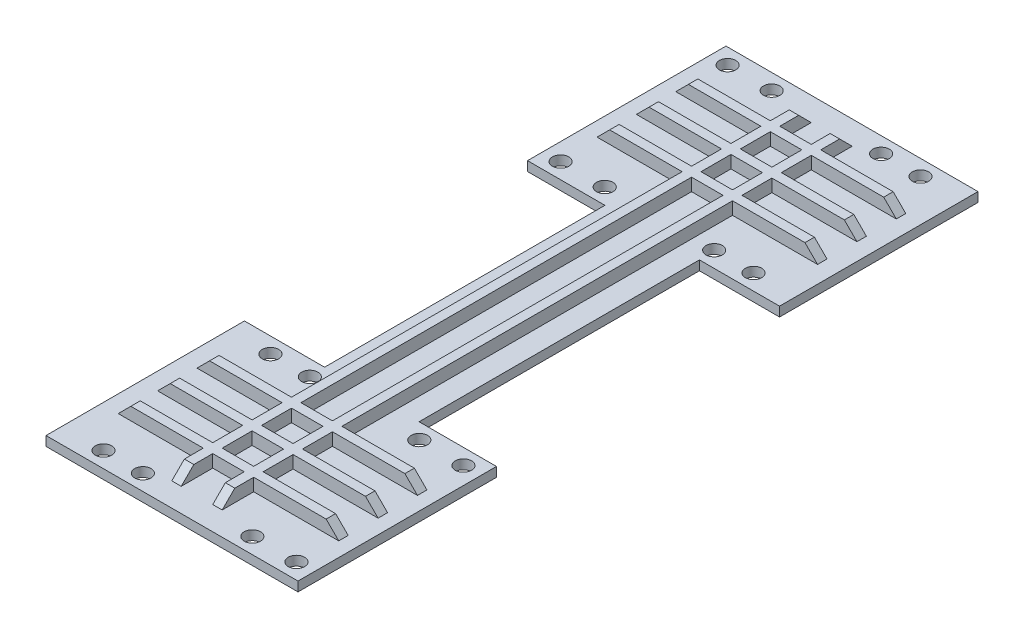
from build123d import *

# Parameters (mm, degrees)
BOSS_EXTRUDE1_DEPTH          = 3
SKETCH2_R                    = 2.6
CUT_EXTRUDE1_DEPTH           = 115.890534423
CIRPATTERN1_COUNT            = 2
SKETCH4_W                    = 3
SKETCH4_H                    = 100
BOSS_EXTRUDE2_DEPTH          = 4
BOSS_EXTRUDE3_START          = -4
SKETCH5_W                    = 70
SKETCH5_H                    = 3
BOSS_EXTRUDE3_DEPTH          = 4
CHAMFER2_SIZE                = 4
CIRPATTERN2_COUNT            = 2
CHAMFER2_OF_CIRPATTERN2_SIZE = 4


with BuildPart() as part:
    # Sketch1 → Boss-Extrude1 (new body)
    with BuildSketch(Plane(origin=(0, 0, 0), x_dir=(1, 0, 0), z_dir=(0, 1, 0))):
        Polygon((39.57, -44.5), (39.57, -107.5), (-40.43, -107.5), (-40.43, -44.5), (-15, -44.5), (-15, 44.5), (-39.57, 44.5), (-39.57, 107.5), (40.43, 107.5), (40.43, 44.5), (15, 44.5), (15, -44.5), align=None)
    extrude(amount=BOSS_EXTRUDE1_DEPTH)

    # Sketch2 → Cut-Extrude1 (cut, through all)
    with BuildSketch(Plane(origin=(0, 3, 0), x_dir=(1, 0, 0), z_dir=(0, 1, 0))):
        with Locations(Location((20.07, -49.5, 0), (0, 0, 270))):
            Circle(SKETCH2_R)
        with Locations(Location((34.07, -49.5, 0), (0, 0, 270))):
            Circle(SKETCH2_R)
        with Locations(Location((34.07, -102.5, 0), (0, 0, 270))):
            Circle(SKETCH2_R)
        with Locations(Location((20.07, -102.5, 0), (0, 0, 270))):
            Circle(SKETCH2_R)
        with Locations(Location((-14.68, -49.5, 0), (0, 0, 270))):
            Circle(SKETCH2_R)
        with Locations(Location((-27.18, -49.5, 0), (0, 0, 270))):
            Circle(SKETCH2_R)
        with Locations(Location((-14.68, -102.5, 0), (0, 0, 270))):
            Circle(SKETCH2_R)
        with Locations(Location((-27.18, -102.5, 0), (0, 0, 270))):
            Circle(SKETCH2_R)
    cut_extrude1 = extrude(amount=-CUT_EXTRUDE1_DEPTH, mode=Mode.SUBTRACT)

    # CirPattern1: Cut-Extrude1 ×2 about axis
    cirpattern1_axis = Axis((0, 0, 0), (0, 1, 0))
    for i in range(1, CIRPATTERN1_COUNT):
        add(cut_extrude1.rotate(cirpattern1_axis, i * 360 / CIRPATTERN1_COUNT), mode=Mode.SUBTRACT)

    # Sketch4 → Boss-Extrude2 (add)
    with BuildSketch(Plane(origin=(0, 3, 0), x_dir=(1, 0, 0), z_dir=(0, 1, 0))):
        with Locations((6.5, -50)):
            Rectangle(SKETCH4_W, SKETCH4_H)
        with Locations((-6.5, -50)):
            Rectangle(SKETCH4_W, SKETCH4_H)
    boss_extrude2 = extrude(amount=BOSS_EXTRUDE2_DEPTH)

    # Sketch5 → Boss-Extrude3 (add)
    with BuildSketch(Plane(origin=(0, 7, 0), x_dir=(1, 0, 0), z_dir=(0, 1, 0)).offset(BOSS_EXTRUDE3_START)):
        with Locations((0, -88.5)):
            Rectangle(SKETCH5_W, SKETCH5_H)
        with Locations((0, -63.5)):
            Rectangle(SKETCH5_W, SKETCH5_H)
        with Locations((0, -76)):
            Rectangle(SKETCH5_W, SKETCH5_H)
    boss_extrude3 = extrude(amount=BOSS_EXTRUDE3_DEPTH)

    # Chamfer2
    chamfer2_edges = [part.edges().sort_by_distance(p)[0] for p in [
        (35, 7, 63.5),
        (35, 7, 76),
        (35, 7, 88.5),
        (6.5, 7, 100),
        (-6.5, 7, 100),
        (-35, 7, 88.5),
        (-35, 7, 76),
        (-35, 7, 63.5),
    ]]
    chamfer(chamfer2_edges, length=CHAMFER2_SIZE - 0.0001)  # a hair under: the kernel refuses the full size

    # CirPattern2: Boss-Extrude2, Boss-Extrude3 ×2 about axis
    cirpattern2_axis = Axis((0, 0, 0), (0, 1, 0))
    add([boss_extrude2.rotate(cirpattern2_axis, i * 360 / CIRPATTERN2_COUNT) for i in range(1, CIRPATTERN2_COUNT)])
    add([boss_extrude3.rotate(cirpattern2_axis, i * 360 / CIRPATTERN2_COUNT) for i in range(1, CIRPATTERN2_COUNT)])

    # Chamfer2 of CirPattern2
    chamfer2_of_cirpattern2_edges = [part.edges().sort_by_distance(p)[0] for p in [
        (-35, 7, -63.5),
        (-35, 7, -76),
        (-35, 7, -88.5),
        (-6.5, 7, -100),
        (6.5, 7, -100),
        (35, 7, -88.5),
        (35, 7, -76),
        (35, 7, -63.5),
    ]]
    chamfer(chamfer2_of_cirpattern2_edges, length=CHAMFER2_OF_CIRPATTERN2_SIZE - 0.0001)  # a hair under: the kernel refuses the full size


solid = part.part
